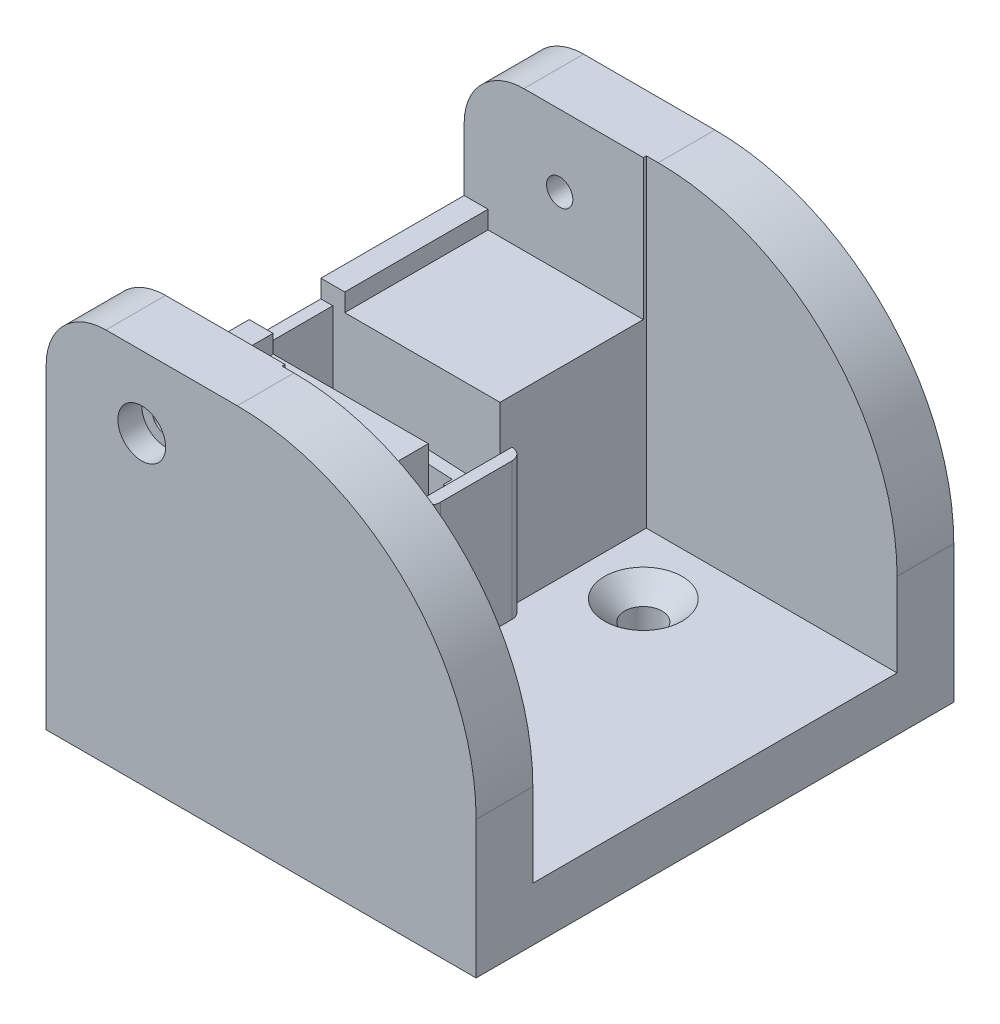
from build123d import *

# Parameters (mm, degrees)
BASE_W                              = 36
BASE_H                              = 30
BOSS_EXTRUDE1_DEPTH                 = 4.5
WALLS_W                             = 36
WALLS_H                             = 5
WALLS_EXT_DEPTH                     = 31.5
SWITCH_BLOCK_W                      = 15
SWITCH_BLOCK_H                      = 30
SWITCH_BLOCK_EXT_DEPTH              = 15.25
MAGNET_POCKET_R                     = 6.25
MAGNET_POCKET_CUT_DEPTH             = 3.75
FILLET1_R                           = 5
FILLET2_R                           = 5
FILLET3_R                           = 20
FILLET4_R                           = 20
SWITCH_PLACE_W                      = 14
SWITCH_PLACE_H                      = 6
SWITCH_POCKET_DEPTH                 = 6.75
SWITCH_CONTACTS_W                   = 14
SWITCH_CONTACTS_H                   = 2.5
SWITCH_LEADS_DEPTH                  = 7
SWITCH_ANGLE_LEFT_DEPTH             = 1.75
SWITCH_ANGLE_RIGHT_DEPTH            = 1.75
WIRE_GUIDE_W                        = 8
WIRE_GUIDE_H                        = 4
WIRE_PASS_THROUGH_DEPTH             = 6
WIRE_PASS_THROUGH_DIRECTION_2_REACH = 39.071
WIRE_CHANNEL_OUTLINE_W              = 4
WIRE_CHANNEL_OUTLINE_H              = 4
WIRE_CHANNEL_DEPTH                  = 1.5
ACHSE_R                             = 1.1
M2_ACHSE_DEPTH                      = 55.002314765
M2_NUT_DEPTH                        = 2.5
SKETCH2_R                           = 1.575
M3_MOUNTING_SCREWS_DEPTH            = 4.5
SKETCH9_W                           = 2
SKETCH9_H                           = 1.5
BOSS_EXTRUDE3_DEPTH                 = 12
SKETCH10_W                          = 2
SKETCH10_H                          = 1.5
BOSS_EXTRUDE4_DEPTH                 = 12
SKETCH18_W                          = 8
SKETCH18_H                          = 11.5
BOSS_EXTRUDE5_DEPTH                 = 1
FILLET5_R                           = 1
FILLET6_R                           = 1
SKETCH19_W                          = 21
SKETCH19_H                          = 27
CUT_EXTRUDE1_DEPTH                  = 0.25
SKETCH20_W                          = 21
SKETCH20_H                          = 27
CUT_EXTRUDE2_DEPTH                  = 0.25
SKETCH21_R                          = 2
CUT_EXTRUDE3_DEPTH                  = 2


# Read off the part's stored shape, not the designer's step: Wire Channel
with BuildPart() as part:
    # Base → Boss-Extrude1 (new body)
    with BuildSketch(Plane(origin=(0, 0, 0), x_dir=(1, 0, 0), z_dir=(0, 1, 0))):
        Rectangle(BASE_W, BASE_H)
    extrude(amount=BOSS_EXTRUDE1_DEPTH)

    # Walls → Walls Ext (add)
    with BuildSketch(Plane.XZ):
        with Locations((0, 17.5)):
            Rectangle(WALLS_W, WALLS_H)
        with Locations((0, -17.5)):
            Rectangle(WALLS_W, WALLS_H)
    extrude(amount=-WALLS_EXT_DEPTH)

    # Switch Block → Switch Block Ext (add)
    with BuildSketch(Plane(origin=(0, 4.5, 0), x_dir=(1, 0, 0), z_dir=(0, 1, 0))):
        with Locations((-10.5, 0)):
            Rectangle(SWITCH_BLOCK_W, SWITCH_BLOCK_H)
    extrude(amount=SWITCH_BLOCK_EXT_DEPTH)

    # Magnet Pocket → Magnet Pocket Cut (cut)
    with BuildSketch(Plane(origin=(0, 0, 0), x_dir=(1, 0, 0), z_dir=(0, 1, 0))):
        with Locations(Location((10, 0, 0), (0, 0, 90))):
            Circle(MAGNET_POCKET_R)
    extrude(amount=MAGNET_POCKET_CUT_DEPTH, mode=Mode.SUBTRACT)

    # Fillet1
    fillet1_edges = [part.edges().sort_by_distance(p)[0] for p in [
        (-18, 31.5, -17.5),
    ]]
    fillet(fillet1_edges, radius=FILLET1_R)

    # Fillet2
    fillet2_edges = [part.edges().sort_by_distance(p)[0] for p in [
        (-18, 31.5, 17.5),
    ]]
    fillet(fillet2_edges, radius=FILLET2_R)

    # Fillet3
    fillet3_edges = [part.edges().sort_by_distance(p)[0] for p in [
        (18, 31.5, -17.5),
    ]]
    fillet(fillet3_edges, radius=FILLET3_R)

    # Fillet4
    fillet4_edges = [part.edges().sort_by_distance(p)[0] for p in [
        (18, 31.5, 17.5),
    ]]
    fillet(fillet4_edges, radius=FILLET4_R)

    # Switch Place → Switch Pocket (cut)
    with BuildSketch(Plane(origin=(0, 19.75, 0), x_dir=(1, 0, 0), z_dir=(0, 1, 0))):
        with Locations((-10, 0)):
            Rectangle(SWITCH_PLACE_W, SWITCH_PLACE_H)
    extrude(amount=-SWITCH_POCKET_DEPTH, mode=Mode.SUBTRACT)

    # Switch Contacts → Switch Leads (cut)
    with BuildSketch(Plane(origin=(0, 13, 0), x_dir=(1, 0, 0), z_dir=(0, 1, 0))):
        with Locations((-10, 0)):
            Rectangle(SWITCH_CONTACTS_W, SWITCH_CONTACTS_H)
    extrude(amount=-SWITCH_LEADS_DEPTH, mode=Mode.SUBTRACT)

    # Sketch16 → Switch Angle Left (add)
    with BuildSketch(Plane(origin=(0, 0, 3), x_dir=(-1, 0, 0), z_dir=(0, 0, -1))):
        Polygon((17, 13), (17, 13.75), (3, 13), align=None)
    extrude(amount=SWITCH_ANGLE_LEFT_DEPTH)

    # Sketch17 → Switch Angle Right (add)
    with BuildSketch(Plane.XY.offset(-3)):
        Polygon((-17, 13), (-17, 13.75), (-3, 13), align=None)
    extrude(amount=SWITCH_ANGLE_RIGHT_DEPTH)

    # Wire Guide → Wire pass through (cut)
    with BuildSketch(Plane(origin=(0, 6, 0), x_dir=(1, 0, 0), z_dir=(0, 1, 0))):
        with Locations((-10, 0)):
            Rectangle(WIRE_GUIDE_W, WIRE_GUIDE_H)
    extrude(amount=-WIRE_PASS_THROUGH_DEPTH, mode=Mode.SUBTRACT)

    # Wire pass through direction 2: up to this plane
    wire_pass_through_direction_2_end = Plane(origin=(-17, 13.75, -12.770074893), z_dir=(-0.05349472137161193, -0.9985681322700889, 0))
    # Wire Guide → Wire pass through direction 2 (cut, up to the surface)
    with BuildSketch(Plane(origin=(0, 6, 0), x_dir=(1, 0, 0), z_dir=(0, 1, 0)), mode=Mode.PRIVATE) as wire_pass_through_direction_2_sk1:
        with Locations((-10, 0)):
            Rectangle(WIRE_GUIDE_W, WIRE_GUIDE_H)
    wire_pass_through_direction_2_tool1 = split(extrude(wire_pass_through_direction_2_sk1.sketch, amount=WIRE_PASS_THROUGH_DIRECTION_2_REACH, mode=Mode.PRIVATE), bisect_by=wire_pass_through_direction_2_end, keep=Keep.BOTH, mode=Mode.PRIVATE)
    add(wire_pass_through_direction_2_tool1.solids().sort_by_distance((-10, 6, 0))[0], mode=Mode.SUBTRACT)

    # Wire Channel outline → Wire Channel (cut)
    with BuildSketch(Plane(origin=(0, 0, 0), x_dir=(1, 0, 0), z_dir=(0, 1, 0))):
        with Locations((-16, 0)):
            Rectangle(WIRE_CHANNEL_OUTLINE_W, WIRE_CHANNEL_OUTLINE_H)
        with BuildLine():
            Line((-6, 2), (-6, -2))
            Line((-6, -2), (0.968804066, -2))
            ThreePointArc((0.968804066, -2), (0.75, 0), (0.968804066, 2))
            Line((0.968804066, 2), (-6, 2))
        make_face()
    extrude(amount=WIRE_CHANNEL_DEPTH, mode=Mode.SUBTRACT)

    # Achse → M2 Achse (cut, through all)
    with BuildSketch(Plane.XY.offset(20)):
        with Locations((-10, 25.5)):
            Circle(ACHSE_R)
    extrude(amount=-M2_ACHSE_DEPTH, mode=Mode.SUBTRACT)

    # Sketch5 → M2 Nut (cut)
    with BuildSketch(Plane(origin=(0, 0, -20), x_dir=(-1, 0, 0), z_dir=(0, 0, -1))):
        Polygon((10, 27.6), (8.181346652, 26.55), (8.181346652, 24.45), (10, 23.4), (11.818653348, 24.45), (11.818653348, 26.55), align=None)
    extrude(amount=-M2_NUT_DEPTH, mode=Mode.SUBTRACT)

    # Sketch2 → M3 Mounting Screws (cut)
    with BuildSketch(Plane.XZ):
        with Locations(Location((2, -10, 0), (0, 0, 270))):
            Circle(SKETCH2_R)
        with Locations(Location((2, 10, 0), (0, 0, 270))):
            Circle(SKETCH2_R)
    extrude(amount=-M3_MOUNTING_SCREWS_DEPTH, mode=Mode.SUBTRACT)

    # M3 Senkkopf cone 1 section (through the dimple's axis) → M3 Senkkopf (revolve, cut)
    with BuildSketch(Plane(origin=(2, 4.5, 10), x_dir=(0, 0, 1), z_dir=(1, 0, 0))):
        Polygon((0, 0), (3.25, 0), (0, 3.25), align=None)
    revolve(axis=Axis((2, 4.5, 10), (0, -1, 0)), mode=Mode.SUBTRACT)

    # M3 Senkkopf cone 2 section (through the dimple's axis) → M3 Senkkopf cone 2 (revolve, cut)
    with BuildSketch(Plane(origin=(2, 4.5, -10), x_dir=(0, 0, 1), z_dir=(1, 0, 0))):
        Polygon((0, 0), (3.25, 0), (0, 3.25), align=None)
    revolve(axis=Axis((2, 4.5, -10), (0, -1, 0)), mode=Mode.SUBTRACT)

    # Sketch9 → Boss-Extrude3 (add)
    with BuildSketch(Plane.XY.offset(-15)):
        with Locations((-17, 20.5)):
            Rectangle(SKETCH9_W, SKETCH9_H)
    extrude(amount=BOSS_EXTRUDE3_DEPTH)

    # Sketch10 → Boss-Extrude4 (add)
    with BuildSketch(Plane(origin=(0, 0, 15), x_dir=(-1, 0, 0), z_dir=(0, 0, -1))):
        with Locations((17, 20.5)):
            Rectangle(SKETCH10_W, SKETCH10_H)
    extrude(amount=BOSS_EXTRUDE4_DEPTH)

    # Sketch18 → Boss-Extrude5 (add)
    with BuildSketch(Plane(origin=(-3, 0, 0), x_dir=(0, 0, -1), z_dir=(1, 0, 0))):
        with Locations((0, 10.25)):
            Rectangle(SKETCH18_W, SKETCH18_H)
    extrude(amount=BOSS_EXTRUDE5_DEPTH)

    # Fillet5
    fillet5_edges = [part.edges().sort_by_distance(p)[0] for p in [
        (-2, 10.25, 4),
    ]]
    fillet(fillet5_edges, radius=FILLET5_R - 0.0001)  # a hair under: the kernel refuses the full size

    # Fillet6
    fillet6_edges = [part.edges().sort_by_distance(p)[0] for p in [
        (-2, 10.25, -4),
    ]]
    fillet(fillet6_edges, radius=FILLET6_R - 0.0001)  # a hair under: the kernel refuses the full size

    # Sketch19 → Cut-Extrude1 (cut)
    with BuildSketch(Plane(origin=(0, 0, 15), x_dir=(-1, 0, 0), z_dir=(0, 0, -1))):
        with Locations((-7.5, 18)):
            Rectangle(SKETCH19_W, SKETCH19_H)
    extrude(amount=-CUT_EXTRUDE1_DEPTH, mode=Mode.SUBTRACT)

    # Sketch20 → Cut-Extrude2 (cut)
    with BuildSketch(Plane.XY.offset(-15)):
        with Locations((7.5, 18)):
            Rectangle(SKETCH20_W, SKETCH20_H)
    extrude(amount=-CUT_EXTRUDE2_DEPTH, mode=Mode.SUBTRACT)

    # Sketch21 → Cut-Extrude3 (cut)
    with BuildSketch(Plane.XY.offset(20)):
        with Locations((-10, 25.5)):
            Circle(SKETCH21_R)
    extrude(amount=-CUT_EXTRUDE3_DEPTH, mode=Mode.SUBTRACT)


solid = part.part
